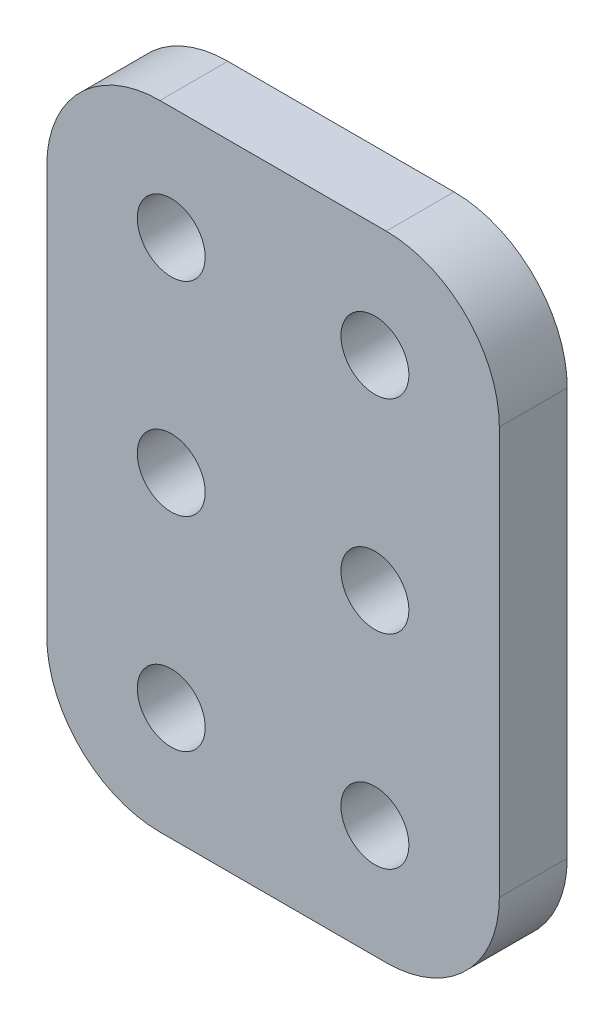
from build123d import *

# Parameters (mm, degrees)
SKETCH1_W           = 20
SKETCH1_H           = 28
BOSS_EXTRUDE1_DEPTH = 3
SKETCH2_R           = 1.5
CUT_EXTRUDE1_DEPTH  = 18.464249197
FILLET1_R           = 5


with BuildPart() as part:
    # Sketch1 → Boss-Extrude1 (new body)
    with BuildSketch(Plane.XY):
        Rectangle(SKETCH1_W, SKETCH1_H)
    extrude(amount=BOSS_EXTRUDE1_DEPTH)

    # Sketch2 → Cut-Extrude1 (cut, through all)
    with BuildSketch(Plane(origin=(0, 0, 0), x_dir=(-1, 0, 0), z_dir=(0, 0, -1))):
        with Locations((4.5, -9)):
            Circle(SKETCH2_R)
        with Locations((-4.5, -9)):
            Circle(SKETCH2_R)
        with Locations((-4.5, 0)):
            Circle(SKETCH2_R)
        with Locations((4.5, 0)):
            Circle(SKETCH2_R)
        with Locations((4.5, 9)):
            Circle(SKETCH2_R)
        with Locations((-4.5, 9)):
            Circle(SKETCH2_R)
    extrude(amount=-CUT_EXTRUDE1_DEPTH, mode=Mode.SUBTRACT)

    # Fillet1
    fillet1_edges = [part.edges().sort_by_distance(p)[0] for p in [
        (-10, -14, 1.5),
        (10, -14, 1.5),
        (-10, 14, 1.5),
        (10, 14, 1.5),
    ]]
    fillet(fillet1_edges, radius=FILLET1_R)


solid = part.part
